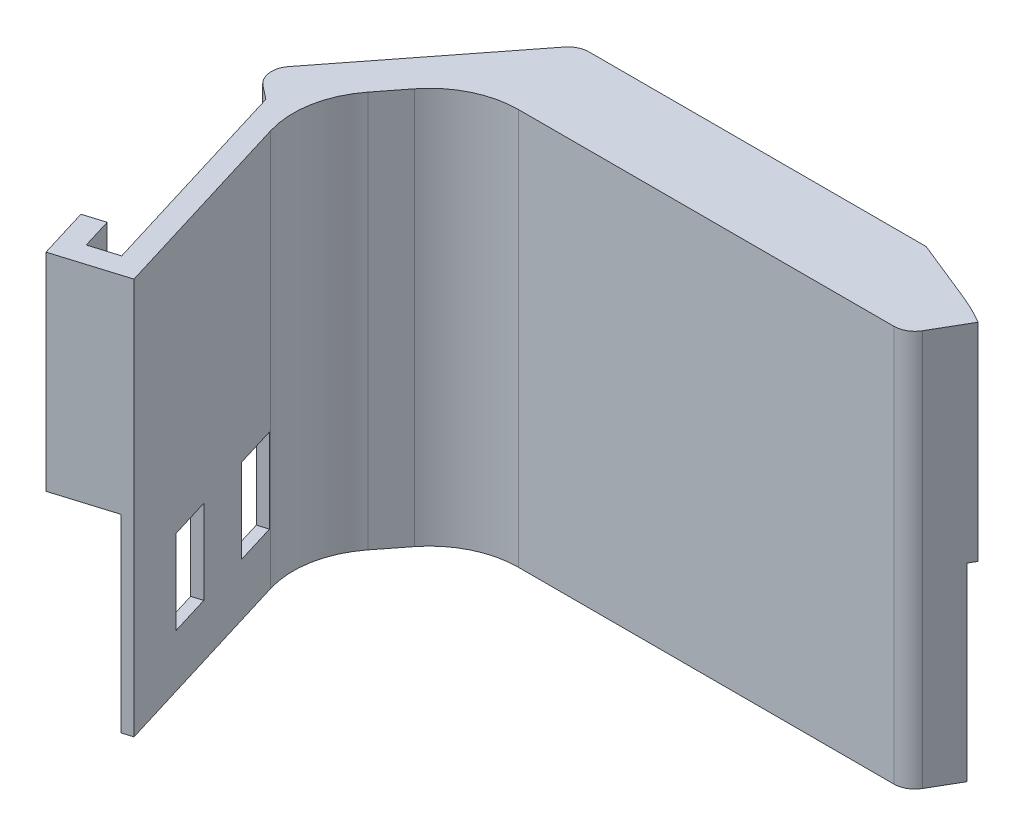
from build123d import *

# Parameters (mm, degrees)
EXTRUDE_THIN1_DEPTH  = 17
BOSS_EXTRUDE1_DEPTH  = 17
BOSS_EXTRUDE3_START  = 18
BOSS_EXTRUDE3_DEPTH  = 18
BOSS_EXTRUDE10_START = 18
BOSS_EXTRUDE10_DEPTH = 18
SKETCH6_W            = 4
SKETCH6_H            = 8
CUT_EXTRUDE1_DEPTH   = 1
BOSS_EXTRUDE4_DEPTH  = 18
CUT_EXTRUDE3_START   = -18
CUT_EXTRUDE3_DEPTH   = 18
BOSS_EXTRUDE5_DEPTH  = 17
BOSS_EXTRUDE6_DEPTH  = 2
SKETCH12_W           = 5
SKETCH12_H           = 1
BOSS_EXTRUDE8_DEPTH  = 33
SKETCH15_W           = 11.8
SKETCH15_H           = 8
CUT_EXTRUDE4_DEPTH   = 1
FILLET1_R            = 2
SKETCH16_W           = 30
SKETCH16_H           = 2
BOSS_EXTRUDE11_DEPTH = 18
BOSS_EXTRUDE12_START = -35
BOSS_EXTRUDE12_DEPTH = 35
SKETCH18_W           = 30
SKETCH18_H           = 35
CUT_EXTRUDE5_DEPTH   = 0.5
BOSS_EXTRUDE13_DEPTH = 2.7
BOSS_EXTRUDE14_START = -19.7
BOSS_EXTRUDE14_DEPTH = 19.7
SKETCH22_W           = 1
SKETCH22_H           = 18
BOSS_EXTRUDE15_DEPTH = 2
BOSS_EXTRUDE16_DEPTH = 19.7
BOSS_EXTRUDE17_DEPTH = 18
FILLET2_R            = 1
FILLET3_R            = 1
FILLET4_R            = 2
FILLET5_R            = 2
FILLET6_R            = 2


# Read off the part's stored shape, not the designer's step: Extrude-Thin1
with BuildPart() as part:
    # Extrude-Thin1 outline → Extrude-Thin1 (new body)
    with BuildSketch(Plane(origin=(0, 0, 0), x_dir=(1, 0, 0), z_dir=(0, 1, 0))):
        with BuildLine():
            Line((-13.736803788, -12.452377644), (-7.480049307, -32.917299422))
            Line((-7.480049307, -32.917299422), (-5.567439795, -32.332556012))
            Line((-5.567439795, -32.332556012), (-11.824194276, -11.867634235))
            ThreePointArc((-11.824194276, -11.867634235), (-11.857842102, -11.27507721), (-11.614075704, -10.733935872))
            Line((-11.614075704, -10.733935872), (-2, 1.571519877))
            Line((-2, 1.571519877), (-2, -2))
            Line((-2, -2), (32, -2))
            Line((32, -2), (32, 2.05634332))
            Line((32, 2.05634332), (34.813889941, 0.919457988))
            Line((34.813889941, 0.919457988), (35.563103127, 2.773825697))
            Line((35.563103127, 2.773825697), (30, 5.021465257))
            Line((30, 5.021465257), (30, 0))
            Line((30, 0), (0, 0))
            Line((0, 0), (0, 6.1))
            Line((0, 6.1), (-1, 6.1))
            Line((-1, 6.1), (-13.190097211, -9.502612921))
            ThreePointArc((-13.190097211, -9.502612921), (-13.824351917, -10.910606158), (-13.736803788, -12.452377644))
        make_face()
    extrude(amount=EXTRUDE_THIN1_DEPTH)

    # Sketch2 → Boss-Extrude1 (add)
    with BuildSketch(Plane(origin=(0, 17, 0), x_dir=(1, 0, 0), z_dir=(0, 1, 0))):
        Polygon((32, -2), (32, 2.05634332), (34.813889941, 0.919457988), align=None)
        Polygon((-2, -2), (-2, 1.571519877), (-5.158478254, -2.471147935), align=None)
    extrude(amount=-BOSS_EXTRUDE1_DEPTH)

    # Sketch5 → Boss-Extrude3 (add)
    with BuildSketch(Plane.XZ.offset(BOSS_EXTRUDE3_START)):
        with BuildLine():
            Line((-2, 2), (-5.158478254, 2.471147935))
            Line((-5.158478254, 2.471147935), (-11.614075704, 10.733935872))
            ThreePointArc((-11.614075704, 10.733935872), (-11.857842102, 11.27507721), (-11.824194276, 11.867634235))
            Line((-11.824194276, 11.867634235), (-5.567439795, 32.332556012))
            Line((-5.567439795, 32.332556012), (-6.523744551, 32.624927717))
            Line((-6.523744551, 32.624927717), (-12.780499032, 12.160005939))
            ThreePointArc((-12.780499032, 12.160005939), (-12.84109701, 11.092841684), (-12.402086458, 10.118274397))
            Line((-12.402086458, 10.118274397), (0, -5.755672387))
            Line((0, -5.755672387), (0, 2))
            Line((0, 2), (-2, 2))
        make_face()
    extrude(amount=-BOSS_EXTRUDE3_DEPTH)

    # Sketch14 → Boss-Extrude10 (add)
    with BuildSketch(Plane.XZ.offset(BOSS_EXTRUDE10_START)):
        with BuildLine():
            Line((0, -6.1), (-1, -6.1))
            Line((-1, -6.1), (-13.190097211, 9.502612921))
            ThreePointArc((-13.190097211, 9.502612921), (-13.824351917, 10.910606159), (-13.736803788, 12.452377644))
            Line((-13.736803788, 12.452377644), (-12.780499032, 12.160005939))
            ThreePointArc((-12.780499032, 12.160005939), (-12.84109701, 11.092841684), (-12.402086458, 10.118274397))
            Line((-12.402086458, 10.118274397), (0, -5.755672387))
            Line((0, -5.755672387), (0, -6.1))
        make_face()
    extrude(amount=-BOSS_EXTRUDE10_DEPTH)

    # Sketch6 → Cut-Extrude1 (cut)
    with BuildSketch(Plane(origin=(-15.087900976, 0, 4.612834247), x_dir=(0.2923717047227341, 0, 0.9563047559630363), z_dir=(-0.9563047559630363, 0, 0.2923717047227341))):
        with Locations((23.292015223, -9)):
            Rectangle(SKETCH6_W, SKETCH6_H)
        with Locations((13.892015223, -9)):
            Rectangle(SKETCH6_W, SKETCH6_H)
    extrude(amount=-CUT_EXTRUDE1_DEPTH, mode=Mode.SUBTRACT)

    # Sketch8 → Boss-Extrude4 (add)
    with BuildSketch(Plane.XZ):
        Polygon((30, -5.021465257), (35.563103127, -2.773825697), (34.813889941, -0.919457988), (32, 2), (30, 2), align=None)
    extrude(amount=BOSS_EXTRUDE4_DEPTH)

    # Sketch9 → Cut-Extrude3 (cut)
    with BuildSketch(Plane.XZ.offset(18).offset(CUT_EXTRUDE3_START)):
        Polygon((30, -5.021465257), (33.708735418, -3.523038884), (32.959522231, -1.668671175), (30, -2.864395772), align=None)
    extrude(amount=CUT_EXTRUDE3_DEPTH, mode=Mode.SUBTRACT)

    # Sketch10 → Boss-Extrude5 (add)
    with BuildSketch(Plane(origin=(0, 17, 0), x_dir=(1, 0, 0), z_dir=(0, 1, 0))):
        Polygon((30, 5.021465257), (25, 5.021465257), (25, 6.1), (30, 6.1), (35.937709721, 3.701009551), (35.563103127, 2.773825697), align=None)
    extrude(amount=-BOSS_EXTRUDE5_DEPTH)

    # Sketch4 → Boss-Extrude6 (add)
    with BuildSketch(Plane.XZ.offset(-17)):
        Polygon((0, 2), (0, -5.1), (5, -5.1), (5, -6.1), (0, -6.1), (-3.030429144, -6.1), (-16.354224478, 10.953680347), (-13.517385765, 13.170061658), (-11.614075704, 10.733935872), (-5.158478254, 2.471147935), (-2, 2), align=None)
    extrude(amount=BOSS_EXTRUDE6_DEPTH)

    # Sketch12 → Boss-Extrude8 (add)
    with BuildSketch(Plane.XZ.offset(-15)):
        with Locations((2.5, -5.6)):
            Rectangle(SKETCH12_W, SKETCH12_H)
    extrude(amount=BOSS_EXTRUDE8_DEPTH)

    # Sketch15 → Cut-Extrude4 (cut)
    with BuildSketch(Plane(origin=(-3.580362913, 0, -2.797286082), x_dir=(-0.6156614753256621, 0, 0.7880107536067191), z_dir=(-0.788010753606719, 0, -0.615661475325662))):
        with Locations((5.708795878, -9)):
            Rectangle(SKETCH15_W, SKETCH15_H)
    extrude(amount=-CUT_EXTRUDE4_DEPTH, mode=Mode.SUBTRACT)

    # Fillet1
    fillet1_edges = [part.edges().sort_by_distance(p)[0] for p in [
        (-1, -9, -6.1),
    ]]
    fillet(fillet1_edges, radius=FILLET1_R)

    # Sketch16 → Boss-Extrude11 (add)
    with BuildSketch(Plane.XZ):
        with Locations((15, 1)):
            Rectangle(SKETCH16_W, SKETCH16_H)
    extrude(amount=BOSS_EXTRUDE11_DEPTH)

    # Sketch17 → Boss-Extrude12 (add)
    with BuildSketch(Plane(origin=(0, 17, 0), x_dir=(1, 0, 0), z_dir=(0, 1, 0)).offset(BOSS_EXTRUDE12_START)):
        with BuildLine():
            Line((-0.672783951, -2), (-2, -2))
            Line((-2, -2), (-5.158478254, -2.471147935))
            Line((-5.158478254, -2.471147935), (-7.325420645, -5.244707716))
            ThreePointArc((-7.325420645, -5.244707716), (-4.373652198, -2.854412758), (-0.672783951, -2))
        make_face()
        with BuildLine():
            Line((-11.824194276, -11.867634235), (-10.706576434, -15.523197479))
            ThreePointArc((-10.706576434, -15.523197479), (-10.93812277, -11.445537112), (-9.260652859, -7.721691994))
            Line((-9.260652859, -7.721691994), (-11.614075704, -10.733935872))
            ThreePointArc((-11.614075704, -10.733935872), (-11.857842102, -11.27507721), (-11.824194276, -11.867634235))
        make_face()
    extrude(amount=BOSS_EXTRUDE12_DEPTH)

    # Sketch18 → Cut-Extrude5 (cut)
    with BuildSketch(Plane(origin=(0, 0, 0), x_dir=(-1, 0, 0), z_dir=(0, 0, -1))):
        with Locations((-15, -0.5)):
            Rectangle(SKETCH18_W, SKETCH18_H)
    extrude(amount=-CUT_EXTRUDE5_DEPTH, mode=Mode.SUBTRACT)

    # Sketch19 → Boss-Extrude13 (add)
    with BuildSketch(Plane(origin=(0, 17, 0), x_dir=(1, 0, 0), z_dir=(0, 1, 0))):
        with BuildLine():
            Line((5, 6.1), (25, 6.1))
            Line((25, 6.1), (30, 6.1))
            Line((30, 6.1), (35.937709721, 3.701009551))
            Line((35.937709721, 3.701009551), (34.813889941, 0.919457988))
            Line((34.813889941, 0.919457988), (32, -2))
            Line((32, -2), (-0.672783951, -2))
            ThreePointArc((-0.672783951, -2), (-4.373652198, -2.854412758), (-7.325420645, -5.244707716))
            Line((-7.325420645, -5.244707716), (-9.260652859, -7.721691994))
            ThreePointArc((-9.260652859, -7.721691994), (-10.93812277, -11.445537112), (-10.706576434, -15.523197479))
            Line((-10.706576434, -15.523197479), (-5.567439795, -32.332556012))
            Line((-5.567439795, -32.332556012), (-7.480049307, -32.917299422))
            Line((-7.480049307, -32.917299422), (-13.517385765, -13.170061658))
            Line((-13.517385765, -13.170061658), (-16.354224478, -10.953680347))
            Line((-16.354224478, -10.953680347), (-3.030429144, 6.1))
            Line((-3.030429144, 6.1), (5, 6.1))
        make_face()
    extrude(amount=BOSS_EXTRUDE13_DEPTH)

    # Sketch21 → Boss-Extrude14 (add)
    with BuildSketch(Plane(origin=(0, 19.7, 0), x_dir=(1, 0, 0), z_dir=(0, 1, 0)).offset(BOSS_EXTRUDE14_START)):
        Polygon((-4.982696385, -34.245165524), (-5.567439795, -32.332556012), (-10.062072148, -33.706703024), (-10.939187262, -30.837788757), (-12.851796774, -31.422532166), (-11.38993825, -36.204055946), align=None)
    extrude(amount=BOSS_EXTRUDE14_DEPTH)

    # Sketch22 → Boss-Extrude15 (add)
    with BuildSketch(Plane(origin=(8.564156426, 0, 28.01209347), x_dir=(0.9563047559630371, 0, -0.2923717047227314), z_dir=(0.2923717047227314, 0, 0.9563047559630371))):
        with Locations((-15.277293674, -9)):
            Rectangle(SKETCH22_W, SKETCH22_H)
    extrude(amount=BOSS_EXTRUDE15_DEPTH)

    # Sketch23 → Boss-Extrude16 (add)
    with BuildSketch(Plane(origin=(0, 19.7, 0), x_dir=(1, 0, 0), z_dir=(0, 1, 0))):
        with BuildLine():
            Line((34.813889941, 0.919457988), (35.937709721, 3.701009551))
            ThreePointArc((35.937709721, 3.701009551), (37.340267778, 3.071287576), (38.690914739, 2.336800231))
            Line((38.690914739, 2.336800231), (36.18124714, -2))
            Line((36.18124714, -2), (32, -2))
            Line((32, -2), (34.813889941, 0.919457988))
        make_face()
    extrude(amount=-BOSS_EXTRUDE16_DEPTH)

    # Sketch24 → Boss-Extrude17 (add)
    with BuildSketch(Plane.XZ):
        Polygon((36.18124714, 2), (32, 2), (34.813889941, -0.919457988), (35.563103127, -2.773825697), (38.303171931, -1.66676604), align=None)
    extrude(amount=BOSS_EXTRUDE17_DEPTH)

    # Fillet2
    fillet2_edges = [part.edges().sort_by_distance(p)[0] for p in [
        (30, -9, -2.864395772),
    ]]
    fillet(fillet2_edges, radius=FILLET2_R)

    # Fillet3
    # the kernel refuses this fillet: 1 mm, written as the material it takes off along each edge
    with BuildSketch(Plane(origin=(-13.736803788, -21.611842033, 12.452377644), x_dir=(0.956304755965878, 0, -0.29237170471343904), z_dir=(0, 1, 0))) as fillet3_piece_1:
        with BuildLine():
            CenterArc((1.222368407, 0.974962713), FILLET3_R, 154.303641792, 102.848179104)
            Line((0.321263823, 1.408564523), (0.303241732, 1.417236559))
            ThreePointArc((0.303241732, 1.417236559), (0.061834895, 0.726815775), (-0.02, 0))
            Line((-0.02, 0), (0, -0.02))
            ThreePointArc((0, -0.02), (0.5, -0.02), (0.995552632, -0.019499254))
            Line((0.995552632, -0.019499254), (1, 0))
        make_face()
    extrude(amount=21.611842033, mode=Mode.SUBTRACT)

    # Fillet4
    fillet4_edges = [part.edges().sort_by_distance(p)[0] for p in [
        (-16.354224478, 17.35, 10.953680347),
    ]]
    fillet(fillet4_edges, radius=FILLET4_R)

    # Fillet5
    fillet5_edges = [part.edges().sort_by_distance(p)[0] for p in [
        (-3.030429144, 17.35, -6.1),
    ]]
    fillet(fillet5_edges, radius=FILLET5_R)

    # Fillet6
    fillet6_edges = [part.edges().sort_by_distance(p)[0] for p in [
        (36.18124714, 0.85, 2),
    ]]
    fillet(fillet6_edges, radius=FILLET6_R)


solid = part.part
